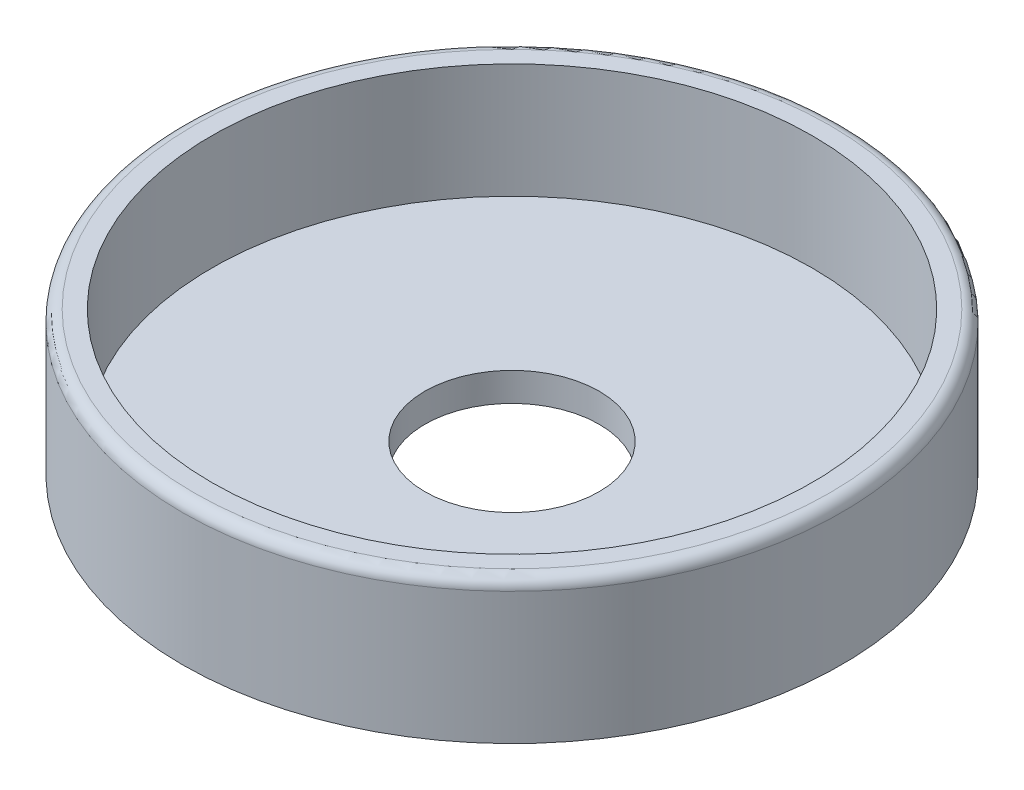
from build123d import *

# Parameters (mm, degrees)
SKETCH1_R           = 73.025
BOSS_EXTRUDE1_DEPTH = 6.35
SKETCH2_R           = 73.025
SKETCH2_R_2         = 66.548
BOSS_EXTRUDE2_DEPTH = 25.4
CUT_EXTRUDE1_REACH  = 110.043
SKETCH3_R           = 19.304
FILLET1_R           = 2.54


with BuildPart() as part:
    # Sketch1 → Boss-Extrude1 (new body)
    with BuildSketch(Plane(origin=(0, 0, 0), x_dir=(1, 0, 0), z_dir=(0, 1, 0))):
        Circle(SKETCH1_R)
    extrude(amount=BOSS_EXTRUDE1_DEPTH)

    # Sketch2 → Boss-Extrude2 (add)
    with BuildSketch(Plane(origin=(0, 6.35, 0), x_dir=(1, 0, 0), z_dir=(0, 1, 0))):
        Circle(SKETCH2_R)
        Circle(SKETCH2_R_2, mode=Mode.SUBTRACT)
    extrude(amount=BOSS_EXTRUDE2_DEPTH)

    # Sketch3 → Cut-Extrude1 (cut, up to next)
    with BuildSketch(Plane.XZ, mode=Mode.PRIVATE) as cut_extrude1_sk1:
        Circle(SKETCH3_R)
    cut_extrude1_tool1 = extrude(cut_extrude1_sk1.sketch, amount=-CUT_EXTRUDE1_REACH, mode=Mode.PRIVATE) & part.part
    add(cut_extrude1_tool1.solids().sort_by_distance((0, 0, 0))[0], mode=Mode.SUBTRACT)

    # Fillet1
    fillet1_edges = [part.edges().sort_by_distance(p)[0] for p in [
        (-73.025, 31.75, 0),
    ]]
    fillet(fillet1_edges, radius=FILLET1_R)


solid = part.part
